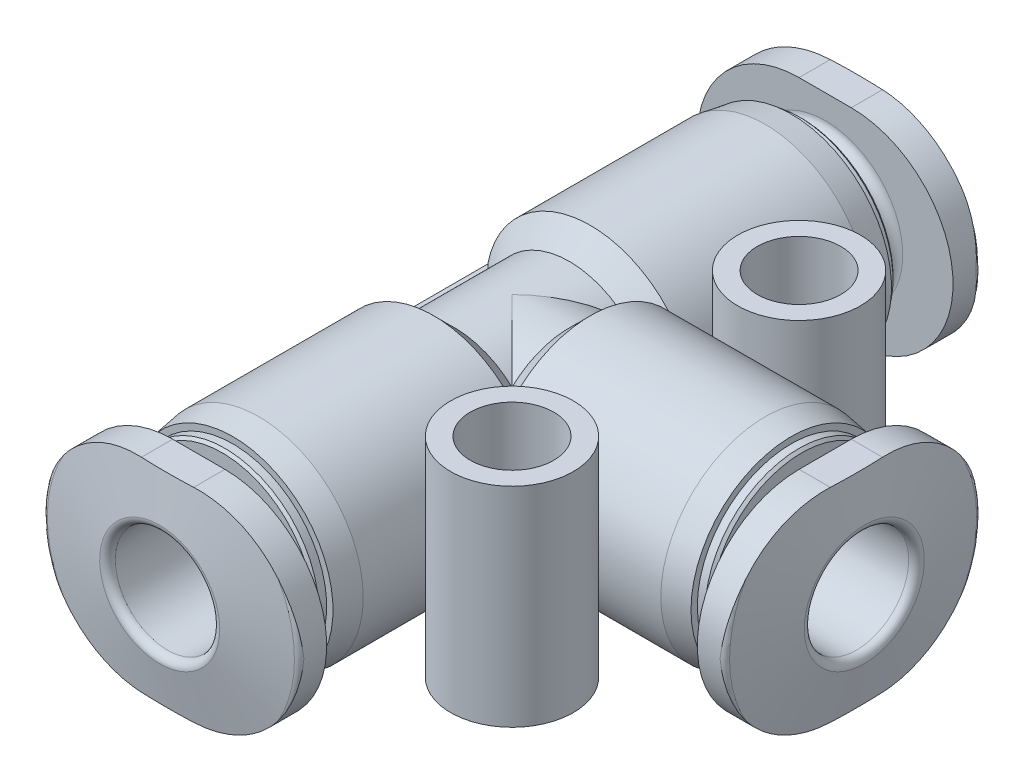
from build123d import *

# Parameters (mm, degrees)
SKETCH2_W                = 40
SKETCH2_H                = 40
CUT_EXTRUDE1_DEPTH       = 1.5
CUT_EXTRUDE2_START       = -1.5
SKETCH3_W                = 40
SKETCH3_H                = 40
CUT_EXTRUDE2_DEPTH       = 1.5
SKETCH5_W                = 40
SKETCH5_H                = 40
CUT_EXTRUDE3_DEPTH       = 1.5
BOSS_EXTRUDE1_DEPTH      = 3
BOSS_EXTRUDE1_DEPTH_BACK = 3
SKETCH7_W                = 2.35
SKETCH7_H                = 8
SKETCH8_W                = 2.35
SKETCH8_H                = 8
SKETCH9_W                = 1.6
SKETCH9_H                = 8
SKETCH10_W               = 1.6
SKETCH10_H               = 8


with BuildPart() as part:
    # Sketch1 → Revolve1 (revolve)
    with BuildSketch(Plane(origin=(0, 0, 0), x_dir=(0, 0, -1), z_dir=(1, 0, 0))):
        with BuildLine():
            Line((-13.5, 0), (-13.5, 2.3))
            Line((-13.5, 2.3), (-13.070691475, 4.734729636))
            ThreePointArc((-13.070691475, 4.734729636), (-13.002287446, 4.853208889), (-12.873729924, 4.9))
            Line((-12.873729924, 4.9), (-12, 4.9))
            Line((-12, 4.9), (-12, 2.975))
            ThreePointArc((-12, 2.975), (-11.890165043, 2.709834957), (-11.625, 2.6))
            Line((-11.625, 2.6), (-11.1, 2.6))
            Line((-11.1, 2.6), (-11.1, 3.5))
            Line((-11.1, 3.5), (-11, 3.6))
            Line((-11, 3.6), (-10.7, 3.6))
            Line((-10.7, 3.6), (-10.7, 3.84161556))
            Line((-10.7, 3.84161556), (-9.7, 4))
            Line((-9.7, 4), (-3, 4))
            Line((-3, 4), (-2.2, 3.2))
            Line((-2.2, 3.2), (2.2, 3.2))
            Line((2.2, 3.2), (3, 4))
            Line((3, 4), (9.7, 4))
            Line((9.7, 4), (10.7, 3.84161556))
            Line((10.7, 3.84161556), (10.7, 3.6))
            Line((10.7, 3.6), (11, 3.6))
            Line((11, 3.6), (11.1, 3.5))
            Line((11.1, 3.5), (11.1, 2.6))
            Line((11.1, 2.6), (11.625, 2.6))
            ThreePointArc((11.625, 2.6), (11.890165043, 2.709834957), (12, 2.975))
            Line((12, 2.975), (12, 4.9))
            Line((12, 4.9), (12.873729924, 4.9))
            ThreePointArc((12.873729924, 4.9), (13.002287446, 4.853208889), (13.070691475, 4.734729636))
            Line((13.070691475, 4.734729636), (13.5, 2.3))
            Line((13.5, 2.3), (13.5, 0))
            Line((13.5, 0), (-13.5, 0))
        make_face()
    revolve(axis=Axis((0, 0, -13.5), (0, 0, 1)))

    # Sketch2 → Cut-Extrude1 (cut)
    with BuildSketch(Plane.XY.offset(-13.5)):
        Rectangle(SKETCH2_W, SKETCH2_H)
        with BuildLine():
            Line((-1, -3.9), (1, -3.9))
            ThreePointArc((1, -3.9), (4.9, 0), (1, 3.9))
            Line((1, 3.9), (-1, 3.9))
            ThreePointArc((-1, 3.9), (-4.9, 0), (-1, -3.9))
        make_face(mode=Mode.SUBTRACT)
    extrude(amount=CUT_EXTRUDE1_DEPTH, mode=Mode.SUBTRACT)

    # Sketch3 → Cut-Extrude2 (cut)
    with BuildSketch(Plane.XY.offset(13.5).offset(CUT_EXTRUDE2_START)):
        Rectangle(SKETCH3_W, SKETCH3_H)
        with BuildLine():
            Line((-1, -3.9), (1, -3.9))
            ThreePointArc((1, -3.9), (4.9, 0), (1, 3.9))
            Line((1, 3.9), (-1, 3.9))
            ThreePointArc((-1, 3.9), (-4.9, 0), (-1, -3.9))
        make_face(mode=Mode.SUBTRACT)
    extrude(amount=CUT_EXTRUDE2_DEPTH, mode=Mode.SUBTRACT)

    # Sketch4 → Revolve2 (revolve)
    with BuildSketch(Plane(origin=(0, 0, 0), x_dir=(1, 0, 0), z_dir=(0, 1, 0))):
        with BuildLine():
            Line((0, 0), (0, 3.2))
            Line((0, 3.2), (2.2, 3.2))
            Line((2.2, 3.2), (3, 4))
            Line((3, 4), (9.7, 4))
            Line((9.7, 4), (10.7, 3.84161556))
            Line((10.7, 3.84161556), (10.7, 3.6))
            Line((10.7, 3.6), (11, 3.6))
            Line((11, 3.6), (11.1, 3.5))
            Line((11.1, 3.5), (11.1, 2.6))
            Line((11.1, 2.6), (11.625, 2.6))
            ThreePointArc((11.625, 2.6), (11.890165043, 2.709834957), (12, 2.975))
            Line((12, 2.975), (12, 4.9))
            Line((12, 4.9), (12.873729924, 4.9))
            ThreePointArc((12.873729924, 4.9), (13.002287446, 4.853208889), (13.070691475, 4.734729636))
            Line((13.070691475, 4.734729636), (13.5, 2.3))
            Line((13.5, 2.3), (13.5, 0))
            Line((13.5, 0), (0, 0))
        make_face()
    revolve(axis=Axis((13.5, 0, 0), (-1, 0, 0)))

    # Sketch5 → Cut-Extrude3 (cut)
    with BuildSketch(Plane(origin=(13.5, 0, 0), x_dir=(0, 0, -1), z_dir=(1, 0, 0))):
        Rectangle(SKETCH5_W, SKETCH5_H)
        with BuildLine():
            Line((-1, -3.9), (1, -3.9))
            ThreePointArc((1, -3.9), (4.9, 0), (1, 3.9))
            Line((1, 3.9), (-1, 3.9))
            ThreePointArc((-1, 3.9), (-4.9, 0), (-1, -3.9))
        make_face(mode=Mode.SUBTRACT)
    extrude(amount=-CUT_EXTRUDE3_DEPTH, mode=Mode.SUBTRACT)

    # Sketch6 → Boss-Extrude1 (add, two sides: drawn at the far end of the back side and taken through both)
    with BuildSketch(Plane.XY.offset(-BOSS_EXTRUDE1_DEPTH_BACK)):
        with BuildLine():
            Line((-3.929058411, -0.75), (0, -0.75))
            Line((0, -0.75), (0, 0.75))
            Line((0, 0.75), (-3.929058411, 0.75))
            ThreePointArc((-3.929058411, 0.75), (-4, 0), (-3.929058411, -0.75))
        make_face()
    extrude(amount=BOSS_EXTRUDE1_DEPTH + BOSS_EXTRUDE1_DEPTH_BACK)

    # Sketch7 → Revolve3 (revolve)
    with BuildSketch(Plane(origin=(5.5, 0, 0), x_dir=(0, 0, -1), z_dir=(1, 0, 0))):
        with Locations((-6.675, 0)):
            Rectangle(SKETCH7_W, SKETCH7_H)
    revolve(axis=Axis((5.5, 4, 5.5), (0, -1, 0)))

    # Sketch8 → Revolve4 (revolve)
    with BuildSketch(Plane(origin=(5.5, 0, 0), x_dir=(0, 0, -1), z_dir=(1, 0, 0))):
        with Locations((4.325, 0)):
            Rectangle(SKETCH8_W, SKETCH8_H)
    revolve(axis=Axis((5.5, 4, -5.5), (0, -1, 0)))

    # Sketch9 → Cut-Revolve1 (revolve, cut)
    with BuildSketch(Plane(origin=(5.5, 0, 0), x_dir=(0, 0, -1), z_dir=(1, 0, 0))):
        with Locations((-6.3, 0)):
            Rectangle(SKETCH9_W, SKETCH9_H)
    revolve(axis=Axis((5.5, 4, 5.5), (0, -1, 0)), mode=Mode.SUBTRACT)

    # Sketch10 → Cut-Revolve2 (revolve, cut)
    with BuildSketch(Plane(origin=(5.5, 0, 0), x_dir=(0, 0, -1), z_dir=(1, 0, 0))):
        with Locations((4.7, 0)):
            Rectangle(SKETCH10_W, SKETCH10_H)
    revolve(axis=Axis((5.5, 4, -5.5), (0, -1, 0)), mode=Mode.SUBTRACT)

    # Sketch11 → Cut-Revolve3 (revolve, cut)
    with BuildSketch(Plane(origin=(0, 0, 0), x_dir=(0, 0, -1), z_dir=(1, 0, 0))):
        with BuildLine():
            Line((-13.5, 0), (-13.5, 2.3))
            ThreePointArc((-13.5, 2.3), (-13.412132034, 2.087867966), (-13.2, 2))
            Line((-13.2, 2), (-2.1, 2))
            ThreePointArc((-2.1, 2), (-2.029289322, 1.970710678), (-2, 1.9))
            Line((-2, 1.9), (-2, 1.5))
            Line((-2, 1.5), (2, 1.5))
            Line((2, 1.5), (2, 1.9))
            ThreePointArc((2, 1.9), (2.029289322, 1.970710678), (2.1, 2))
            Line((2.1, 2), (13.2, 2))
            ThreePointArc((13.2, 2), (13.412132034, 2.087867966), (13.5, 2.3))
            Line((13.5, 2.3), (13.5, 0))
            Line((13.5, 0), (-13.5, 0))
        make_face()
    revolve(axis=Axis((0, 0, -13.5), (0, 0, 1)), mode=Mode.SUBTRACT)

    # Sketch12 → Cut-Revolve4 (revolve, cut)
    with BuildSketch(Plane(origin=(0, 0, 0), x_dir=(1, 0, 0), z_dir=(0, 1, 0))):
        with BuildLine():
            Line((0, 0), (0, 1.5))
            Line((0, 1.5), (2, 1.5))
            Line((2, 1.5), (2, 1.9))
            ThreePointArc((2, 1.9), (2.029289322, 1.970710678), (2.1, 2))
            Line((2.1, 2), (13.2, 2))
            ThreePointArc((13.2, 2), (13.412132034, 2.087867966), (13.5, 2.3))
            Line((13.5, 2.3), (13.5, 0))
            Line((13.5, 0), (0, 0))
        make_face()
    revolve(axis=Axis((13.5, 0, 0), (-1, 0, 0)), mode=Mode.SUBTRACT)


solid = part.part
